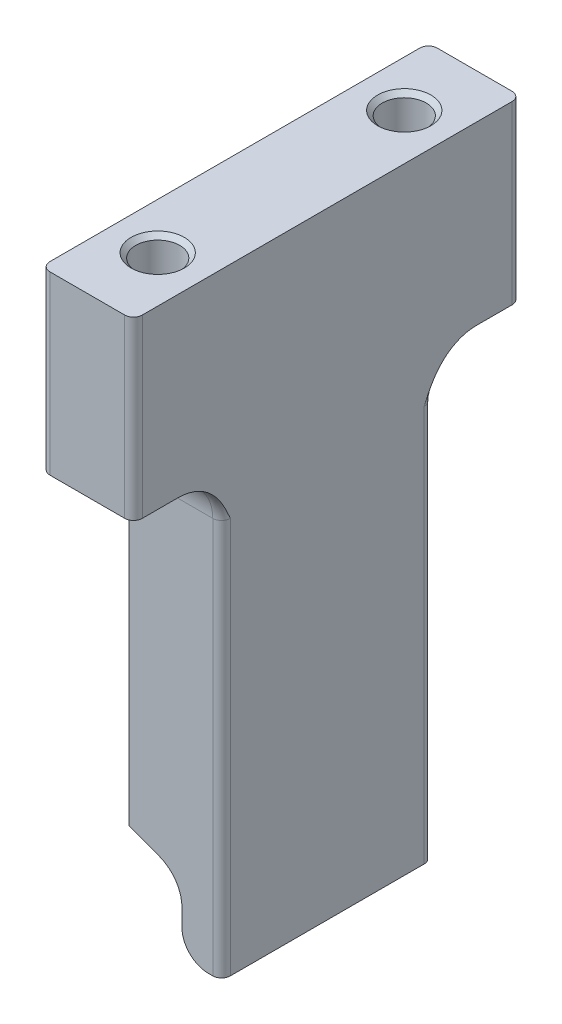
from build123d import *

# Parameters (mm, degrees)
SKETCH1_W                   = 10.5
SKETCH1_H                   = 24
BOSS_EXTRUDE1_DEPTH         = 70
CUT_EXTRUDE1_REACH          = 76.186
FILLET1_R                   = 3
SKETCH3_W                   = 10.5
SKETCH3_H                   = 44
BOSS_EXTRUDE2_DEPTH         = 20
FILLET2_R                   = 1
M6_TAPPED_HOLE1_D           = 5
M6_TAPPED_HOLE1_DEPTH       = 17
M6_TAPPED_HOLE1_CSINK_D     = 6.05
M6_TAPPED_HOLE1_CSINK_ANGLE = 90
M6_TAPPED_HOLE1_TIP         = 1.502151548
FILLET3_R                   = 5
FILLET4_R                   = 1


with BuildPart() as part:
    # Sketch1 → Boss-Extrude1 (new body)
    with BuildSketch(Plane(origin=(0, 0, 0), x_dir=(1, 0, 0), z_dir=(0, 1, 0))):
        Rectangle(SKETCH1_W, SKETCH1_H)
    extrude(amount=-BOSS_EXTRUDE1_DEPTH)

    # Sketch2 → Cut-Extrude1 (cut, up to next)
    with BuildSketch(Plane.XY.offset(12), mode=Mode.PRIVATE) as cut_extrude1_sk1:
        with BuildLine():
            Line((-1.881919427, -61.241229517), (-5.25, -60.015348442))
            Line((-5.25, -60.015348442), (-5.25, -70))
            Line((-5.25, -70), (0.75, -70))
            Line((0.75, -70), (0.75, -65))
            ThreePointArc((0.75, -65), (0.026608177, -62.705694255), (-1.881919427, -61.241229517))
        make_face()
    cut_extrude1_tool1 = extrude(cut_extrude1_sk1.sketch, amount=-CUT_EXTRUDE1_REACH, mode=Mode.PRIVATE) & part.part
    add(cut_extrude1_tool1.solids().sort_by_distance((-2.443278, -65.612177, 12))[0], mode=Mode.SUBTRACT)

    # Fillet1
    fillet1_edges = [part.edges().sort_by_distance(p)[0] for p in [
        (0.75, -70, 0),
    ]]
    fillet(fillet1_edges, radius=FILLET1_R)

    # Sketch3 → Boss-Extrude2 (add)
    with BuildSketch(Plane(origin=(0, 0, 0), x_dir=(1, 0, 0), z_dir=(0, 1, 0))):
        Rectangle(SKETCH3_W, SKETCH3_H)
    extrude(amount=-BOSS_EXTRUDE2_DEPTH)

    # Fillet2
    fillet2_edges = [part.edges().sort_by_distance(p)[0] for p in [
        (5.25, -45, 12),
        (5.25, -45, -12),
    ]]
    fillet(fillet2_edges, radius=FILLET2_R)

    # M6 Tapped Hole1
    with Locations(Plane(origin=(0, 0, 0), x_dir=(1, 0, 0), z_dir=(0, 1, 0))):
        with Locations((0, 14), (0, -14)):
            CounterSinkHole(M6_TAPPED_HOLE1_D / 2, M6_TAPPED_HOLE1_CSINK_D / 2, depth=M6_TAPPED_HOLE1_DEPTH, counter_sink_angle=M6_TAPPED_HOLE1_CSINK_ANGLE)
            with Locations((0, 0, -(M6_TAPPED_HOLE1_DEPTH + M6_TAPPED_HOLE1_TIP / 2))):  # 118° drill point
                Cone(0, M6_TAPPED_HOLE1_D / 2, M6_TAPPED_HOLE1_TIP, mode=Mode.SUBTRACT)

    # Fillet3
    # the kernel refuses this fillet: 5 mm, written as the material it adds along each edge
    with BuildSketch(Plane(origin=(4.25, -20, 12), x_dir=(0, -1, 0), z_dir=(-1, 0, 0)), Plane(origin=(-5.25, -20, -12), x_dir=(0, -1, 0), z_dir=(1, 0, 0))) as fillet3_piece_1:
        with BuildLine():
            CenterArc((FILLET3_R, FILLET3_R), FILLET3_R, 180, 90)
            Line((0, FILLET3_R), (0, 0))
            Line((0, 0), (FILLET3_R, 0))
        make_face()
    extrude(amount=9.5)
    with BuildSketch(Plane(origin=(4.25, -20, -11), x_dir=(0, 0, -1), z_dir=(-1, 0, 0))) as fillet3_piece_2_section:
        with BuildLine():
            CenterArc((1 + FILLET3_R, FILLET3_R), FILLET3_R, 180, 90)
            Line((1, FILLET3_R), (1, 0))
            Line((1, 0), (1 + FILLET3_R, 0))
        make_face()
    fillet3_piece_2 = revolve(axis=Axis((4.25, -20, -11), (0, -1, 0)), revolution_arc=359.64, mode=Mode.PRIVATE)
    fillet3_piece_2 = split(fillet3_piece_2, bisect_by=Plane(origin=(5.25, -21.017365057, -13.137521002), z_dir=(-1, 0, 0)), keep=Keep.TOP, mode=Mode.PRIVATE)
    add(fillet3_piece_2)
    with BuildSketch(Plane(origin=(4.25, -20, 11), x_dir=(0, 0, 1), z_dir=(-1, 0, 0))) as fillet3_piece_3_section:
        with BuildLine():
            CenterArc((1 + FILLET3_R, -FILLET3_R), FILLET3_R, 90, 90)
            Line((1 + FILLET3_R, 0), (1, 0))
            Line((1, 0), (1, -FILLET3_R))
        make_face()
    fillet3_piece_3 = revolve(axis=Axis((4.25, -20, 11), (0, 1, 0)), revolution_arc=359.64, mode=Mode.PRIVATE)
    fillet3_piece_3 = split(fillet3_piece_3, bisect_by=Plane(origin=(5.25, -22.017645533, 11.767475003), z_dir=(-1, 0, 0)), keep=Keep.TOP, mode=Mode.PRIVATE)
    add(fillet3_piece_3)

    # Fillet4
    fillet4_edges = [part.edges().sort_by_distance(p)[0] for p in [
        (-5.25, -10, 22),
        (-5.25, -10, -22),
        (5.25, -10, -22),
        (5.25, -10, 22),
    ]]
    fillet(fillet4_edges, radius=FILLET4_R)


solid = part.part
